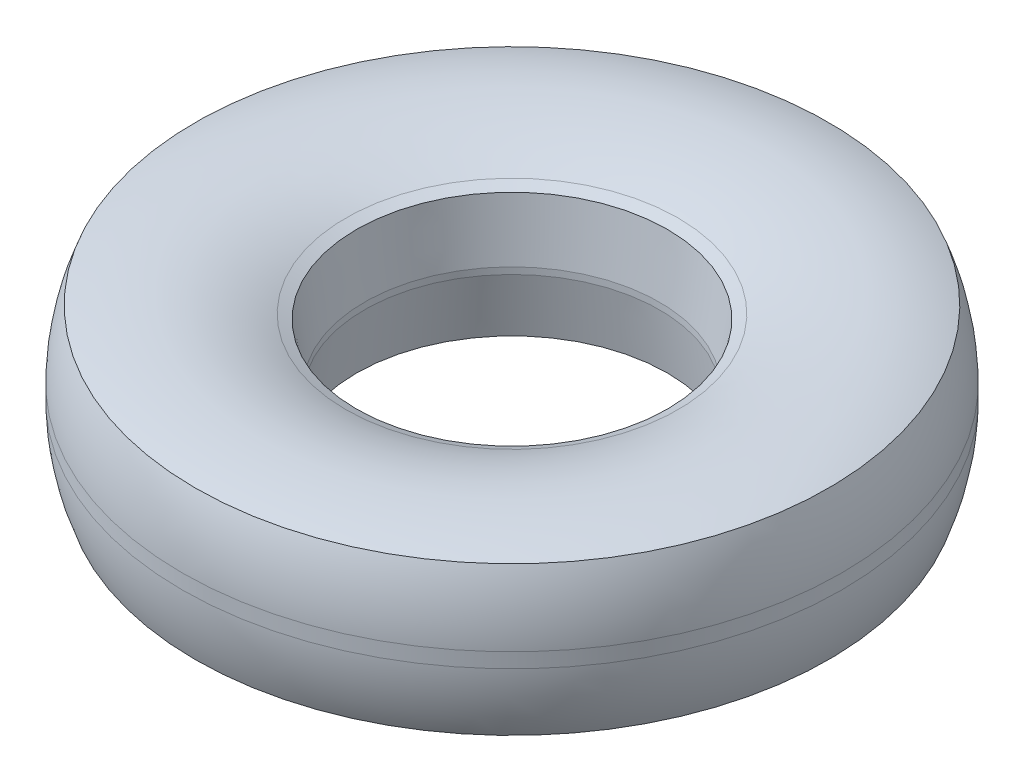
from build123d import *


with BuildPart() as part:
    # Sketch1 → Revolve2 (revolve)
    with BuildSketch(Plane.XY):
        with BuildLine():
            Line((-70.958571646, -1.27), (-74.822704279, 27.066972643))
            Line((-74.822704279, 27.066972643), (-79.890793535, 29.319444643))
            ThreePointArc((-79.890793535, 29.319444643), (-115.772186084, 37.862959149), (-152.320140654, 32.891743198))
            ThreePointArc((-152.320140654, 32.891743198), (-156.913214183, 17.071233071), (-158.630793535, 0.687253509))
            Line((-158.630793535, 0.687253509), (-158.630793535, -6.402312222))
            ThreePointArc((-158.630793535, -6.402312222), (-156.913214183, -22.786291784), (-152.320140654, -38.606801912))
            ThreePointArc((-152.320140654, -38.606801912), (-115.772186084, -43.578017862), (-79.890793535, -35.034503357))
            Line((-79.890793535, -35.034503357), (-74.822704279, -32.782031357))
            Line((-74.822704279, -32.782031357), (-70.958571646, -4.445058713))
            Line((-70.958571646, -4.445058713), (-70.958571646, -1.27))
        make_face()
        with BuildLine():
            Line((-153.550793535, 0.647587981), (-153.550793535, -6.362646694))
            ThreePointArc((-153.550793535, -6.362646694), (-152.147481506, -20.647987955), (-148.4284494, -34.511936159))
            ThreePointArc((-148.4284494, -34.511936159), (-114.820292563, -38.437292619), (-81.953967677, -30.392336572))
            Line((-81.953967677, -30.392336572), (-79.473521394, -29.28992193))
            Line((-79.473521394, -29.28992193), (-76.038571646, -4.10029044))
            Line((-76.038571646, -4.10029044), (-76.038571646, -1.614768274))
            Line((-76.038571646, -1.614768274), (-79.473521394, 23.574863217))
            Line((-79.473521394, 23.574863217), (-81.953967677, 24.677277858))
            ThreePointArc((-81.953967677, 24.677277858), (-114.820292563, 32.722233906), (-148.4284494, 28.796877446))
            ThreePointArc((-148.4284494, 28.796877446), (-152.147481506, 14.932929242), (-153.550793535, 0.647587981))
        make_face(mode=Mode.SUBTRACT)
    revolve(axis=Axis((0, 35.044486122, 0), (0, -1, 0)))


solid = part.part
